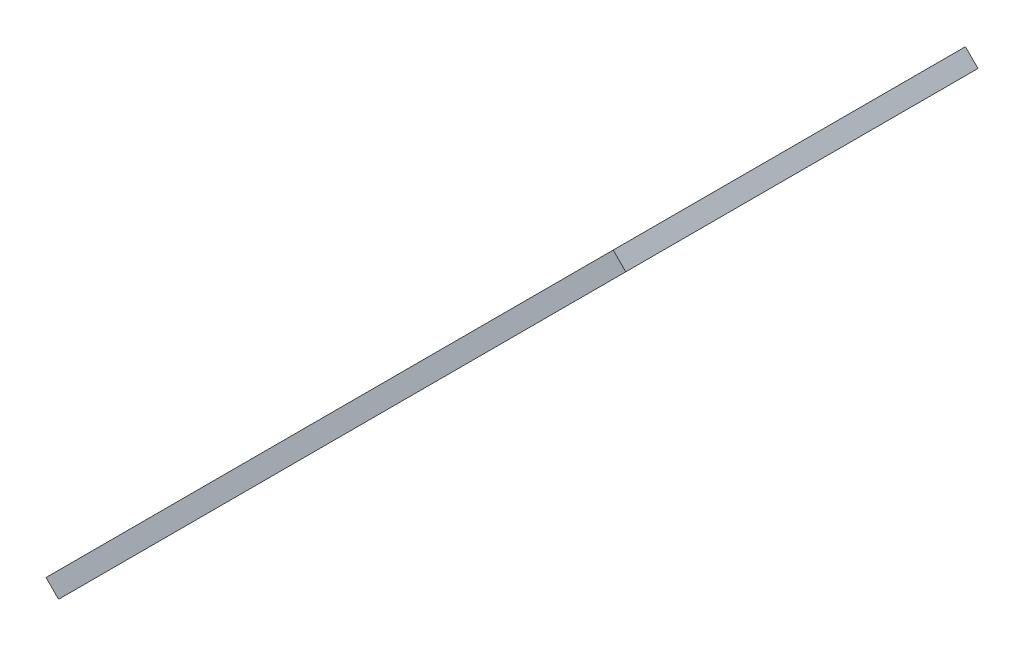
from build123d import *

# Parameters (mm, degrees)
BOSS_EXTRUDE4_DEPTH      = 29.7
BOSS_EXTRUDE4_DEPTH_BACK = 29.7
SKETCH12_R               = 11
SKETCH12_R_2             = 1.5
CUT_EXTRUDE4_DEPTH       = 140.971831538


with BuildPart() as part:
    # Sketch6 → Boss-Extrude4 (new, two sides: drawn at the far end of the back side and taken through both)
    with BuildSketch(Plane.XY.offset(-BOSS_EXTRUDE4_DEPTH_BACK)):
        Polygon((82.4, -82.4), (32, -132.8), (-13.254833996, -178.054833996), (-11.133513652, -180.176154339), (84.521320344, -84.521320344), align=None)
    extrude(amount=BOSS_EXTRUDE4_DEPTH + BOSS_EXTRUDE4_DEPTH_BACK)

    # Sketch12 → Cut-Extrude4 (cut, through all)
    with BuildSketch(Plane(origin=(82.4, -82.4, 0), x_dir=(0, 0, 1), z_dir=(-0.7071067811865472, 0.7071067811865478, 0))):
        with Locations((0, -103.276363544)):
            Circle(SKETCH12_R)
        with Locations((-10.606601718, -113.882965261)):
            Circle(SKETCH12_R_2)
        with Locations((-15.556349186, -118.83271273)):
            Circle(SKETCH12_R_2)
        with Locations((-15.556349186, -87.720014358)):
            Circle(SKETCH12_R_2)
        with Locations((-10.606601718, -92.669761826)):
            Circle(SKETCH12_R_2)
        with Locations((15.556349186, -87.720014358)):
            Circle(SKETCH12_R_2)
        with Locations((10.606601718, -92.669761826)):
            Circle(SKETCH12_R_2)
        with Locations((15.556349186, -118.83271273)):
            Circle(SKETCH12_R_2)
        with Locations((10.606601718, -113.882965261)):
            Circle(SKETCH12_R_2)
    extrude(amount=-CUT_EXTRUDE4_DEPTH, mode=Mode.SUBTRACT)


solid = part.part
